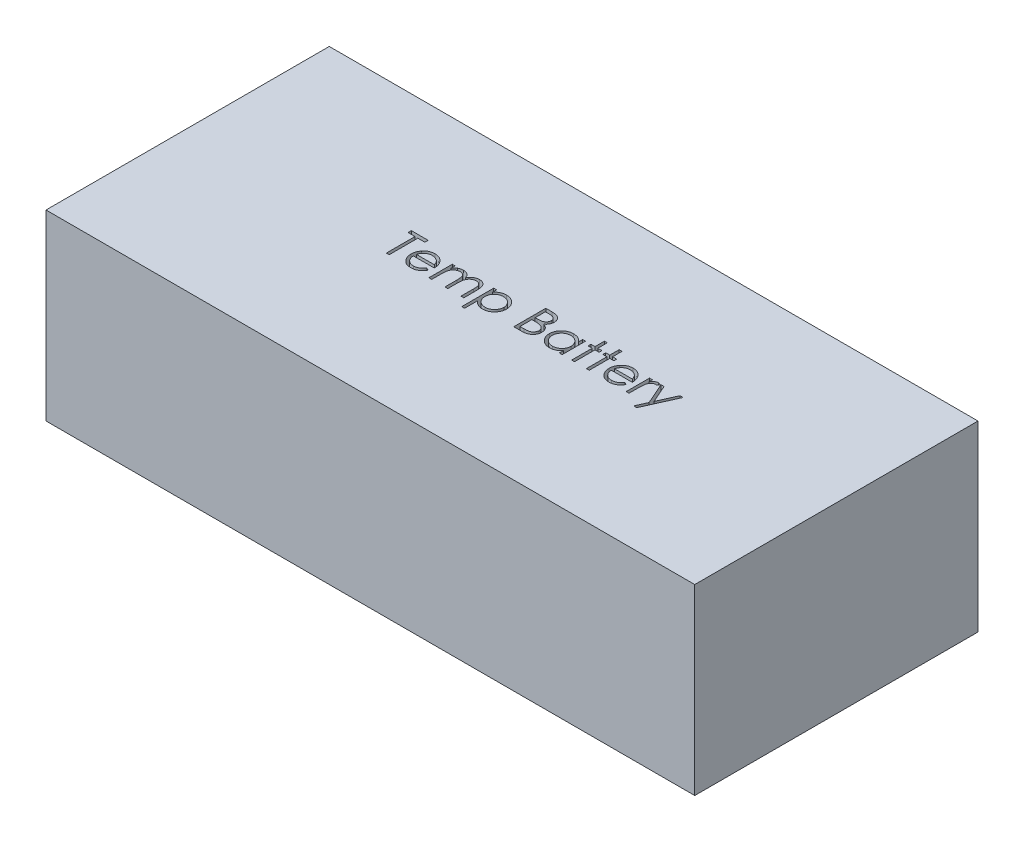
from build123d import *

# Parameters (mm, degrees)
SKETCH1_W           = 71
SKETCH1_H           = 31
BOSS_EXTRUDE1_DEPTH = 20
CUT_EXTRUDE1_DEPTH  = 4


with BuildPart() as part:
    # Sketch1 → Boss-Extrude1 (new body)
    with BuildSketch(Plane(origin=(0, 0, 0), x_dir=(1, 0, 0), z_dir=(0, 1, 0))):
        Rectangle(SKETCH1_W, SKETCH1_H)
    extrude(amount=BOSS_EXTRUDE1_DEPTH)

    # Sketch2 → Cut-Extrude1 (cut)
    # profile 1 of 11: a face of its own
    with BuildSketch(Plane(origin=(0, 20, 0), x_dir=(1, 0, 0), z_dir=(0, 1, 0))):
        Polygon((-13.555817512, 2.176797668), (-13.555817512, 2.535772027), (-11.716073922, 2.535772027), (-11.716073922, 2.176797668), (-12.478894435, 2.176797668), (-12.478894435, -0.964227973), (-12.792996999, -0.964227973), (-12.792996999, 2.176797668), align=None)
    # profile 2 of 11: a face of its own
    with BuildSketch(Plane(origin=(0, 20, 0), x_dir=(1, 0, 0), z_dir=(0, 1, 0))):
        with BuildLine():
            Line((-9.168197319, -0.156535666), (-8.889150845, -0.303070121))
            add(Edge.make_bspline(
                [(-8.889150845, -0.303070121), (-8.91138744, -0.342513452), (-8.954651049, -0.419254555), (-9.029051797, -0.524686415), (-9.107043869, -0.619534131), (-9.192147837, -0.701263785), (-9.281817516, -0.77251517), (-9.376550171, -0.834852995), (-9.476838989, -0.887971515), (-9.582688713, -0.932724043), (-9.694988265, -0.967133537), (-9.814009781, -0.991437758), (-9.939981276, -1.006461027), (-10.026327456, -1.008206168), (-10.070541069, -1.009099768)],
                knots=[0, 0, 0, 0, 1.120438281, 2.179929193, 3.190490725, 4.156257408, 5.095198341, 6.022838206, 6.959905092, 7.901321166, 8.864066838, 9.862729781, 10.905609505, 12, 12, 12, 12], degree=3))
            add(Edge.make_bspline(
                [(-10.070541069, -1.009099768), (-10.119683047, -1.007952593), (-10.215544809, -1.005714786), (-10.355084556, -0.986422322), (-10.486463974, -0.954949963), (-10.609675677, -0.910984421), (-10.72441793, -0.853557097), (-10.830918785, -0.783597616), (-10.929738311, -0.701465361), (-11.01776252, -0.606448917), (-11.097006403, -0.50476696), (-11.166932223, -0.398811076), (-11.225389654, -0.288847851), (-11.272942264, -0.175577327), (-11.311347129, -0.059713434), (-11.338113833, 0.059798034), (-11.353543581, 0.182633618), (-11.355908026, 0.265730954), (-11.357099563, 0.307606963)],
                knots=[0, 0, 0, 0, 1.145258523, 2.234067595, 3.276747158, 4.290159414, 5.277019952, 6.260822364, 7.254936242, 8.264827045, 9.274100331, 10.257902744, 11.220704747, 12.172965371, 13.118907548, 14.062713208, 15.023725156, 16, 16, 16, 16], degree=3))
            add(Edge.make_bspline(
                [(-11.357099563, 0.307606963), (-11.356040422, 0.346901793), (-11.353941343, 0.424778958), (-11.340710556, 0.540044502), (-11.317262263, 0.652072955), (-11.285085939, 0.760957403), (-11.243534693, 0.866515537), (-11.192702474, 0.9688116), (-11.132510096, 1.06773674), (-11.086037422, 1.130139874), (-11.062628409, 1.161573309)],
                knots=[0, 0, 0, 0, 1.024358464, 2.0301432, 3.019427413, 4.004406732, 4.986367066, 5.972626655, 6.978780325, 8, 8, 8, 8], degree=3))
            add(Edge.make_bspline(
                [(-11.062628409, 1.161573309), (-11.030920726, 1.199442179), (-10.96850978, 1.273980329), (-10.862953424, 1.371918655), (-10.748653228, 1.45396243), (-10.627041602, 1.521969566), (-10.496705128, 1.573643213), (-10.359395837, 1.612150796), (-10.213550251, 1.633728807), (-10.11384503, 1.63677664), (-10.06282873, 1.638336129)],
                knots=[0, 0, 0, 0, 1.030682036, 2.02871468, 2.997146059, 3.962720338, 4.930598197, 5.918074684, 6.934738563, 8, 8, 8, 8], degree=3))
            add(Edge.make_bspline(
                [(-10.06282873, 1.638336129), (-10.010381124, 1.63698208), (-9.907490878, 1.634325745), (-9.757458757, 1.609699412), (-9.615498041, 1.570646857), (-9.481665537, 1.515493067), (-9.355947676, 1.444333515), (-9.239161626, 1.356191673), (-9.129310114, 1.253773586), (-9.065401535, 1.175010377), (-9.032880813, 1.134930681)],
                knots=[0, 0, 0, 0, 1.056321875, 2.072262726, 3.055038591, 4.01806755, 4.982017516, 5.957941055, 6.960871419, 8, 8, 8, 8], degree=3))
            add(Edge.make_bspline(
                [(-9.032880813, 1.134930681), (-9.010753875, 1.104727099), (-8.966647282, 1.044520981), (-8.911400182, 0.946349823), (-8.863442787, 0.843639229), (-8.825109826, 0.734728932), (-8.794070324, 0.620909352), (-8.771613506, 0.501366807), (-8.758443887, 0.376136896), (-8.75585519, 0.29081034), (-8.75453546, 0.247310488)],
                knots=[0, 0, 0, 0, 0.94817472, 1.890038105, 2.849395472, 3.817997239, 4.812318967, 5.836947057, 6.897266129, 8, 8, 8, 8], degree=3))
            Line((-8.75453546, 0.247310488), (-11.042996999, 0.247310488))
            add(Edge.make_bspline(
                [(-11.042996999, 0.247310488), (-11.041457392, 0.213610024), (-11.038429818, 0.14733942), (-11.024314675, 0.050368637), (-11.002065902, -0.042004705), (-10.970796839, -0.129087747), (-10.932929994, -0.212017874), (-10.886544277, -0.290179911), (-10.831204723, -0.363217841), (-10.769479024, -0.431784979), (-10.700771928, -0.49284574), (-10.628489181, -0.547497516), (-10.551595616, -0.593303113), (-10.470697532, -0.630483003), (-10.385925747, -0.659589319), (-10.297253552, -0.67945714), (-10.204855436, -0.692764247), (-10.141869702, -0.694243912), (-10.10980389, -0.694997204)],
                knots=[0, 0, 0, 0, 1.094153842, 2.151609401, 3.174256925, 4.172055639, 5.149267565, 6.128595816, 7.11444997, 8.118368179, 9.117203808, 10.09244225, 11.054858984, 12.015122123, 12.976791628, 13.957293641, 14.960065497, 16, 16, 16, 16], degree=3))
            add(Edge.make_bspline(
                [(-10.10980389, -0.694997204), (-10.078452742, -0.694389147), (-10.016246051, -0.693182646), (-9.923605194, -0.681450735), (-9.832465667, -0.66248046), (-9.743204683, -0.63659047), (-9.657633837, -0.605013618), (-9.578388287, -0.56691076), (-9.505508072, -0.524761013), (-9.437391105, -0.476551338), (-9.371320112, -0.417543151), (-9.305777625, -0.34390743), (-9.235500972, -0.256819902), (-9.191511379, -0.191274236), (-9.168197319, -0.156535666)],
                knots=[0, 0, 0, 0, 0.99110716, 1.966546729, 2.947904876, 3.932708344, 4.903319531, 5.828989031, 6.710028674, 7.56322171, 8.463672341, 9.504779593, 10.677557249, 12, 12, 12, 12], degree=3))
        make_face()
        with BuildLine():
            add(Edge.make_bspline(
                [(-9.068638025, 0.561413052), (-9.080134649, 0.603075926), (-9.102261951, 0.683263547), (-9.148498315, 0.794304437), (-9.200569856, 0.892992338), (-9.262191587, 0.978571971), (-9.332010313, 1.054575484), (-9.412655495, 1.120994069), (-9.503091389, 1.18041152), (-9.60285053, 1.23056402), (-9.708492315, 1.273253879), (-9.819098507, 1.301878994), (-9.931956294, 1.321488537), (-10.008290581, 1.323314645), (-10.046702928, 1.324233565)],
                knots=[0, 0, 0, 0, 1.154881502, 2.222775134, 3.210006277, 4.132804581, 5.035138423, 5.962687519, 6.919655026, 7.923214229, 8.944639381, 9.960483929, 10.97369054, 12, 12, 12, 12], degree=3))
            add(Edge.make_bspline(
                [(-10.046702928, 1.324233565), (-10.078052367, 1.323621894), (-10.140023616, 1.322412748), (-10.231324684, 1.310942618), (-10.319004383, 1.291982773), (-10.403709671, 1.266017817), (-10.484330539, 1.231409214), (-10.562525307, 1.190825988), (-10.636305703, 1.141284404), (-10.682446999, 1.103525549), (-10.705757416, 1.084449911)],
                knots=[0, 0, 0, 0, 1.04873581, 2.073130211, 3.073294108, 4.04793562, 5.032784715, 6.005352987, 6.992311501, 8, 8, 8, 8], degree=3))
            add(Edge.make_bspline(
                [(-10.705757416, 1.084449911), (-10.722450697, 1.069355596), (-10.756233832, 1.03880838), (-10.801374353, 0.986179173), (-10.844594826, 0.929427611), (-10.883928479, 0.866382486), (-10.920006065, 0.797761707), (-10.953766042, 0.724144072), (-10.984152454, 0.644970942), (-11.001248564, 0.589798503), (-11.010044275, 0.561413052)],
                knots=[0, 0, 0, 0, 0.879870761, 1.780643979, 2.707998968, 3.669668524, 4.684282772, 5.740141944, 6.837334558, 8, 8, 8, 8], degree=3))
            Line((-11.010044275, 0.561413052), (-9.068638025, 0.561413052))
        make_face(mode=Mode.SUBTRACT)
    # profile 3 of 11: a face of its own
    with BuildSketch(Plane(origin=(0, 20, 0), x_dir=(1, 0, 0), z_dir=(0, 1, 0))):
        with BuildLine():
            Line((-8.126330332, 1.593464334), (-7.812227768, 1.593464334))
            Line((-7.812227768, 1.593464334), (-7.812227768, 1.148953117))
            add(Edge.make_bspline(
                [(-7.812227768, 1.148953117), (-7.783943818, 1.187840718), (-7.729749059, 1.262353091), (-7.640883406, 1.360543376), (-7.552107294, 1.44387153), (-7.488173912, 1.487614402), (-7.45746014, 1.508628597)],
                knots=[0, 0, 0, 0, 1.134379233, 2.173579362, 3.122582517, 4, 4, 4, 4], degree=3))
            add(Edge.make_bspline(
                [(-7.45746014, 1.508628597), (-7.415595478, 1.528633963), (-7.332597578, 1.568295176), (-7.201178353, 1.608528735), (-7.066703684, 1.633253836), (-6.97589547, 1.63663521), (-6.93021655, 1.638336129)],
                knots=[0, 0, 0, 0, 1.014936303, 2.012140481, 3.000054389, 4, 4, 4, 4], degree=3))
            add(Edge.make_bspline(
                [(-6.93021655, 1.638336129), (-6.899323554, 1.637290839), (-6.838187975, 1.635222264), (-6.747603884, 1.621762229), (-6.659745273, 1.598496056), (-6.575131243, 1.566088732), (-6.495410564, 1.526842045), (-6.422321366, 1.480792337), (-6.356697158, 1.429095262), (-6.298571107, 1.369416329), (-6.246302081, 1.30007973), (-6.198223235, 1.219215482), (-6.153798022, 1.12500782), (-6.129176714, 1.056641279), (-6.116214146, 1.020647828)],
                knots=[0, 0, 0, 0, 1.009824226, 1.998387844, 2.986035974, 3.974953746, 4.955485308, 5.885931332, 6.793869504, 7.679848016, 8.601185859, 9.625726857, 10.749998409, 12, 12, 12, 12], degree=3))
            add(Edge.make_bspline(
                [(-6.116214146, 1.020647828), (-6.102502895, 1.045372247), (-6.075521078, 1.094026432), (-6.030215441, 1.162884695), (-5.982747644, 1.227291486), (-5.932713151, 1.287297911), (-5.880288564, 1.342607641), (-5.825227164, 1.393403543), (-5.767842383, 1.439903756), (-5.688050143, 1.494226916), (-5.584237535, 1.551928097), (-5.453349421, 1.601956541), (-5.317199249, 1.63287267), (-5.224781551, 1.636502943), (-5.178113185, 1.638336129)],
                knots=[0, 0, 0, 0, 0.86119277, 1.694706429, 2.50939023, 3.298075842, 4.073795165, 4.829715201, 5.57930267, 6.321991688, 7.768977793, 9.186738141, 10.579381044, 12, 12, 12, 12], degree=3))
            add(Edge.make_bspline(
                [(-5.178113185, 1.638336129), (-5.135231722, 1.636718908), (-5.051308536, 1.63355385), (-4.92913127, 1.608700377), (-4.815189465, 1.56602273), (-4.709712389, 1.507789093), (-4.614552575, 1.43460991), (-4.531836266, 1.347541072), (-4.462065903, 1.247198449), (-4.416487263, 1.152806461), (-4.385571999, 1.069471128), (-4.366510764, 0.998464836), (-4.349671069, 0.920313284), (-4.335689824, 0.834923022), (-4.325471272, 0.741992414), (-4.317900556, 0.641673538), (-4.312776483, 0.533888426), (-4.312414411, 0.459522926), (-4.312227768, 0.421188693)],
                knots=[0, 0, 0, 0, 1.209669288, 2.367440248, 3.500751976, 4.631527125, 5.755587489, 6.87532382, 8.007944318, 9.190864318, 9.82315674, 10.514484317, 11.263564316, 12.079023757, 12.955305781, 13.901327259, 14.918167583, 16, 16, 16, 16], degree=3))
            Line((-4.312227768, 0.421188693), (-4.312227768, -0.964227973))
            Line((-4.312227768, -0.964227973), (-4.626330332, -0.964227973))
            Line((-4.626330332, -0.964227973), (-4.626330332, 0.422590937))
            add(Edge.make_bspline(
                [(-4.626330332, 0.422590937), (-4.626408215, 0.455311511), (-4.626557894, 0.518195478), (-4.629251526, 0.608447929), (-4.63432684, 0.690716286), (-4.640261479, 0.764888374), (-4.648505288, 0.831137163), (-4.65915122, 0.889329581), (-4.6704289, 0.939923393), (-4.689164891, 0.99600944), (-4.719112783, 1.057879651), (-4.764730263, 1.124603227), (-4.822200369, 1.182684027), (-4.888560525, 1.233102344), (-4.96410897, 1.274095985), (-5.047373693, 1.303371995), (-5.137837745, 1.321494873), (-5.200460533, 1.323300889), (-5.232800685, 1.324233565)],
                knots=[0, 0, 0, 0, 1.253487763, 2.409012846, 3.458416907, 4.410876679, 5.259312806, 6.014470957, 6.676830364, 7.243083969, 8.276244668, 9.299465089, 10.325150304, 11.392391894, 12.482080715, 13.603491619, 14.762376348, 16, 16, 16, 16], degree=3))
            add(Edge.make_bspline(
                [(-5.232800685, 1.324233565), (-5.272470639, 1.322817408), (-5.35087355, 1.320018542), (-5.465319037, 1.29144467), (-5.575290053, 1.248364419), (-5.677505186, 1.185931962), (-5.771532977, 1.111123598), (-5.852432554, 1.022174002), (-5.91926474, 0.921544075), (-5.964518716, 0.828397373), (-5.993108017, 0.744727929), (-6.011984933, 0.671630557), (-6.026668325, 0.588548989), (-6.040438854, 0.496041498), (-6.049426582, 0.393471318), (-6.057594954, 0.281312917), (-6.061415817, 0.159228957), (-6.061950276, 0.074602269), (-6.062227768, 0.030663854)],
                knots=[0, 0, 0, 0, 1.090531906, 2.155305635, 3.229839962, 4.33261226, 5.44038871, 6.529323825, 7.629011124, 8.757537029, 9.370236727, 10.061839251, 10.834451254, 11.692844982, 12.636905849, 13.66920014, 14.789842145, 16, 16, 16, 16], degree=3))
            Line((-6.062227768, 0.030663854), (-6.062227768, -0.964227973))
            Line((-6.062227768, -0.964227973), (-6.376330332, -0.964227973))
            Line((-6.376330332, -0.964227973), (-6.376330332, 0.336352956))
            add(Edge.make_bspline(
                [(-6.376330332, 0.336352956), (-6.376409763, 0.373046275), (-6.37656258, 0.443640532), (-6.379238898, 0.544874208), (-6.384325519, 0.636955288), (-6.390206068, 0.719776751), (-6.398666246, 0.79318808), (-6.408276008, 0.857582838), (-6.419624619, 0.912799589), (-6.438414504, 0.973362974), (-6.467128972, 1.040083897), (-6.513317234, 1.111224918), (-6.570924814, 1.173493016), (-6.63849569, 1.226651764), (-6.714501372, 1.270593246), (-6.798484773, 1.302252997), (-6.889689686, 1.320677287), (-6.952567392, 1.323025784), (-6.98490405, 1.324233565)],
                knots=[0, 0, 0, 0, 1.320475261, 2.540461679, 3.643808994, 4.639130445, 5.527981419, 6.302341397, 6.981980563, 7.553956391, 8.582137848, 9.585246428, 10.591171744, 11.620968678, 12.668337649, 13.738356861, 14.836885341, 16, 16, 16, 16], degree=3))
            add(Edge.make_bspline(
                [(-6.98490405, 1.324233565), (-7.022920262, 1.322703105), (-7.098685221, 1.319652953), (-7.209987191, 1.292198679), (-7.317472874, 1.249194604), (-7.419427573, 1.189534785), (-7.513101721, 1.115635706), (-7.595109989, 1.028720811), (-7.664052514, 0.929871777), (-7.709784329, 0.837707261), (-7.739282803, 0.756133986), (-7.758878138, 0.686783038), (-7.775717764, 0.60978279), (-7.788231785, 0.524895679), (-7.800312201, 0.432674585), (-7.80614251, 0.332660095), (-7.811814072, 0.224938007), (-7.812086487, 0.150565462), (-7.812227768, 0.111993982)],
                knots=[0, 0, 0, 0, 1.098833095, 2.189935336, 3.297829714, 4.440610912, 5.596351641, 6.740013378, 7.886572111, 9.072425424, 9.705826452, 10.395263256, 11.156850408, 11.985370555, 12.878090359, 13.847760091, 14.883794034, 16, 16, 16, 16], degree=3))
            Line((-7.812227768, 0.111993982), (-7.812227768, -0.964227973))
            Line((-7.812227768, -0.964227973), (-8.126330332, -0.964227973))
            Line((-8.126330332, -0.964227973), (-8.126330332, 1.593464334))
        make_face()
    # profile 4 of 11: a face of its own
    with BuildSketch(Plane(origin=(0, 20, 0), x_dir=(1, 0, 0), z_dir=(0, 1, 0))):
        with BuildLine():
            Line((-3.59427905, 1.593464334), (-3.280176486, 1.593464334))
            Line((-3.280176486, 1.593464334), (-3.280176486, 1.120207123))
            add(Edge.make_bspline(
                [(-3.280176486, 1.120207123), (-3.246819002, 1.163144857), (-3.181995407, 1.24658575), (-3.070270502, 1.354575878), (-2.952343694, 1.445651182), (-2.825180281, 1.517033715), (-2.690756591, 1.570854527), (-2.549624274, 1.610633977), (-2.400585509, 1.634075451), (-2.298689056, 1.636897112), (-2.24672296, 1.638336129)],
                knots=[0, 0, 0, 0, 1.0828784, 2.104357462, 3.088488658, 4.04616522, 5.001424249, 5.969181776, 6.964304535, 8, 8, 8, 8], degree=3))
            add(Edge.make_bspline(
                [(-2.24672296, 1.638336129), (-2.201331357, 1.63702295), (-2.111612469, 1.634427383), (-1.97954924, 1.616854329), (-1.852373856, 1.586736636), (-1.730805802, 1.543335721), (-1.613542737, 1.489680251), (-1.502320637, 1.421963216), (-1.395407082, 1.343557025), (-1.295490893, 1.253324874), (-1.203169525, 1.155696607), (-1.123323344, 1.050674303), (-1.05445144, 0.941711717), (-0.998781143, 0.827119625), (-0.955172796, 0.707800395), (-0.924158118, 0.583271954), (-0.905700475, 0.453996014), (-0.903224023, 0.366093293), (-0.901971358, 0.321629399)],
                knots=[0, 0, 0, 0, 1.041296284, 2.058176809, 3.050446431, 4.034000596, 5.01514041, 6.003636468, 7.015969324, 8.052561599, 9.08815499, 10.094063707, 11.074456064, 12.040834395, 13.011057502, 13.983766392, 14.980127149, 16, 16, 16, 16], degree=3))
            add(Edge.make_bspline(
                [(-0.901971358, 0.321629399), (-0.903196843, 0.27622709), (-0.905613678, 0.186687186), (-0.924358684, 0.055200088), (-0.954315558, -0.071287286), (-0.997373741, -0.192564549), (-1.053015229, -0.3085482), (-1.12071979, -0.419154596), (-1.200606257, -0.5243483), (-1.291907385, -0.6227012), (-1.390960321, -0.713300513), (-1.49683781, -0.792538582), (-1.607896736, -0.859079958), (-1.723568903, -0.914662917), (-1.844844541, -0.956555101), (-1.971157819, -0.986772902), (-2.102439965, -1.005407397), (-2.191741117, -1.00785954), (-2.236907255, -1.009099768)],
                knots=[0, 0, 0, 0, 1.038740735, 2.04854663, 3.033179607, 4.009277356, 4.987731542, 5.972001279, 6.972200261, 8.005528982, 9.039189865, 10.040446548, 11.026516639, 11.997840187, 12.972163198, 13.956796175, 14.96660207, 16, 16, 16, 16], degree=3))
            add(Edge.make_bspline(
                [(-2.236907255, -1.009099768), (-2.287734827, -1.00780496), (-2.388134183, -1.005247336), (-2.534931854, -0.979327925), (-2.676208706, -0.94059099), (-2.81039953, -0.883891996), (-2.938567343, -0.81163648), (-3.059987149, -0.723526274), (-3.175303902, -0.61974565), (-3.244712659, -0.541013833), (-3.280176486, -0.500786467)],
                knots=[0, 0, 0, 0, 1.014726462, 2.004382257, 2.969841629, 3.936926163, 4.907207904, 5.903978561, 6.929055279, 8, 8, 8, 8], degree=3))
            Line((-3.280176486, -0.500786467), (-3.280176486, -1.906535666))
            Line((-3.280176486, -1.906535666), (-3.59427905, -1.906535666))
            Line((-3.59427905, -1.906535666), (-3.59427905, 1.593464334))
        make_face()
        with BuildLine():
            add(Edge.make_bspline(
                [(-2.249527448, 1.324233565), (-2.28510701, 1.323593307), (-2.355153998, 1.322332804), (-2.457826217, 1.307358855), (-2.556721645, 1.285621114), (-2.650843596, 1.252709213), (-2.741094212, 1.2123104), (-2.826778377, 1.161828389), (-2.907835945, 1.102176383), (-2.984062975, 1.034497039), (-3.052926269, 0.959922351), (-3.113889197, 0.880334542), (-3.165096502, 0.795834402), (-3.207598522, 0.70720904), (-3.239941805, 0.613763755), (-3.262897524, 0.516030742), (-3.277327877, 0.41390303), (-3.279216815, 0.344347023), (-3.280176486, 0.309009206)],
                knots=[0, 0, 0, 0, 1.05670511, 2.080379991, 3.077984906, 4.06214886, 5.038337365, 6.01289324, 7.01187578, 8.025460281, 9.038092164, 10.024533457, 11.000252242, 11.969694649, 12.940728589, 13.933144304, 14.949937299, 16, 16, 16, 16], degree=3))
            add(Edge.make_bspline(
                [(-3.280176486, 0.309009206), (-3.27858563, 0.262621094), (-3.275469008, 0.171742853), (-3.25013164, 0.038958731), (-3.208896376, -0.086692925), (-3.150367662, -0.204153962), (-3.076420088, -0.312136797), (-2.987321932, -0.408827404), (-2.883879381, -0.493617995), (-2.767812189, -0.565039248), (-2.643390058, -0.623027315), (-2.513604146, -0.664541525), (-2.380239265, -0.690113753), (-2.290070946, -0.693360572), (-2.244619595, -0.694997204)],
                knots=[0, 0, 0, 0, 1.03728447, 2.032128127, 3.01272805, 3.987917167, 4.958271349, 5.931593992, 6.91984656, 7.941419022, 8.973179163, 9.983609215, 10.983593296, 12, 12, 12, 12], degree=3))
            add(Edge.make_bspline(
                [(-2.244619595, -0.694997204), (-2.200083827, -0.693440827), (-2.111688334, -0.690351699), (-1.981530213, -0.663613511), (-1.855039574, -0.622768487), (-1.734859402, -0.56320893), (-1.622035914, -0.490218872), (-1.52015436, -0.402658839), (-1.431147447, -0.301168896), (-1.355283092, -0.188160393), (-1.294151606, -0.066985009), (-1.248221367, 0.058396379), (-1.221712793, 0.187541802), (-1.217956005, 0.274539515), (-1.216073922, 0.31812379)],
                knots=[0, 0, 0, 0, 1.00104056, 1.986885549, 2.97790532, 3.984399681, 4.995088187, 5.994304198, 6.996462723, 8.023150851, 9.048424203, 10.043036403, 11.019596776, 12, 12, 12, 12], degree=3))
            add(Edge.make_bspline(
                [(-1.216073922, 0.31812379), (-1.217528656, 0.361978779), (-1.22042679, 0.449347082), (-1.248973827, 0.578109985), (-1.291873805, 0.703997961), (-1.354432857, 0.823518511), (-1.428634126, 0.936292594), (-1.518381123, 1.035846473), (-1.61899732, 1.123017146), (-1.731686484, 1.195032555), (-1.852626909, 1.25231805), (-1.979941825, 1.294201689), (-2.112985428, 1.319375439), (-2.203613082, 1.322599945), (-2.249527448, 1.324233565)],
                knots=[0, 0, 0, 0, 0.983928682, 1.960191568, 2.949917689, 3.96440592, 4.982380491, 5.975291189, 6.965713506, 7.964880129, 8.970154049, 9.96478489, 10.968906225, 12, 12, 12, 12], degree=3))
        make_face(mode=Mode.SUBTRACT)
    # profile 5 of 11: a face of its own
    with BuildSketch(Plane(origin=(0, 20, 0), x_dir=(1, 0, 0), z_dir=(0, 1, 0))):
        with BuildLine():
            Line((1.162131206, 2.535772027), (1.845023834, 2.535772027))
            add(Edge.make_bspline(
                [(1.845023834, 2.535772027), (1.878452313, 2.535596276), (1.943245023, 2.535255628), (2.037464465, 2.529972497), (2.125713275, 2.522768827), (2.208017048, 2.511338735), (2.28433775, 2.497546958), (2.354905387, 2.480845141), (2.41949556, 2.460818528), (2.496608296, 2.428972247), (2.584528957, 2.381649078), (2.67972735, 2.311720513), (2.761131589, 2.22618805), (2.831317906, 2.129705395), (2.887119026, 2.023569623), (2.927488323, 1.910310434), (2.953046199, 1.791388692), (2.955674633, 1.709745514), (2.957003001, 1.668484367)],
                knots=[0, 0, 0, 0, 1.001505555, 1.941167018, 2.826882275, 3.653841531, 4.429895133, 5.150066043, 5.825578002, 6.45369114, 7.647487171, 8.808567382, 9.977351308, 11.170798116, 12.373658725, 13.556498008, 14.765093433, 16, 16, 16, 16], degree=3))
            add(Edge.make_bspline(
                [(2.957003001, 1.668484367), (2.955909783, 1.629831811), (2.953761505, 1.553875894), (2.933218746, 1.442781785), (2.901058078, 1.337030566), (2.856352828, 1.23700818), (2.798250832, 1.144974567), (2.729392514, 1.060187301), (2.646315711, 0.986236244), (2.584072471, 0.944893342), (2.552455725, 0.92389302)],
                knots=[0, 0, 0, 0, 1.044552857, 2.05264487, 3.044412934, 4.028983338, 5.005914585, 5.980388656, 6.974128949, 8, 8, 8, 8], degree=3))
            add(Edge.make_bspline(
                [(2.552455725, 0.92389302), (2.592216153, 0.908628021), (2.6682877, 0.879422297), (2.772973713, 0.827786833), (2.863168558, 0.771624723), (2.939565704, 0.710292872), (3.004903359, 0.644184062), (3.0619563, 0.572328947), (3.110637675, 0.49379019), (3.152350598, 0.409386654), (3.184899354, 0.319980186), (3.209275258, 0.22640941), (3.223242708, 0.129009855), (3.225230349, 0.062724475), (3.22623377, 0.02926161)],
                knots=[0, 0, 0, 0, 1.27268992, 2.434971085, 3.483601985, 4.442670788, 5.356604649, 6.2567628, 7.179492994, 8.113709626, 9.066344395, 10.018646069, 10.999752585, 12, 12, 12, 12], degree=3))
            add(Edge.make_bspline(
                [(3.22623377, 0.02926161), (3.225256924, -0.004905262), (3.223334952, -0.07212954), (3.209154981, -0.170884675), (3.185145874, -0.265259621), (3.152074727, -0.355864804), (3.108912413, -0.442524938), (3.056384448, -0.525338202), (2.993752885, -0.603472533), (2.923690016, -0.677796156), (2.84442787, -0.744623944), (2.758912115, -0.80413965), (2.666065795, -0.853085712), (2.567413801, -0.894201734), (2.461849485, -0.925608932), (2.349846878, -0.947581506), (2.231502576, -0.962386543), (2.150292825, -0.963603748), (2.108645629, -0.964227973)],
                knots=[0, 0, 0, 0, 0.978564426, 1.925352924, 2.850884081, 3.763762016, 4.682927383, 5.618979971, 6.567305752, 7.547517671, 8.540179244, 9.531824382, 10.526200242, 11.540722885, 12.589160233, 13.674978461, 14.80764778, 16, 16, 16, 16], degree=3))
            Line((2.108645629, -0.964227973), (1.162131206, -0.964227973))
            Line((1.162131206, -0.964227973), (1.162131206, 2.535772027))
        make_face()
        with BuildLine():
            Line((1.47623377, 2.176797668), (1.47623377, 1.055002796))
            Line((1.47623377, 1.055002796), (1.687271431, 1.055002796))
            add(Edge.make_bspline(
                [(1.687271431, 1.055002796), (1.718120226, 1.055402719), (1.777726385, 1.056175452), (1.864046282, 1.058388969), (1.9441713, 1.064587012), (2.017963133, 1.070783274), (2.085305577, 1.080857862), (2.146049439, 1.092849985), (2.201148035, 1.10553289), (2.264687581, 1.127102377), (2.336760529, 1.158980052), (2.413593634, 1.208451888), (2.481328103, 1.267376241), (2.538525291, 1.335367203), (2.585336761, 1.410233389), (2.617850477, 1.490780269), (2.639897761, 1.575000401), (2.641889292, 1.632818654), (2.642900437, 1.66217427)],
                knots=[0, 0, 0, 0, 1.156816544, 2.235205308, 3.236616184, 4.169592532, 5.011045266, 5.787822928, 6.49130361, 7.128639758, 8.301311294, 9.436451833, 10.541879658, 11.654887649, 12.756523258, 13.837046038, 14.901820046, 16, 16, 16, 16], degree=3))
            add(Edge.make_bspline(
                [(2.642900437, 1.66217427), (2.642374257, 1.681600042), (2.641342097, 1.719705814), (2.632888794, 1.775255168), (2.61852122, 1.827498921), (2.600066927, 1.877153031), (2.574278238, 1.922664881), (2.543914775, 1.965608077), (2.507229084, 2.004520195), (2.465471772, 2.040889694), (2.417463149, 2.073134221), (2.363231857, 2.101374985), (2.30204418, 2.124115761), (2.234931325, 2.144031914), (2.160860237, 2.158020208), (2.080685684, 2.169673595), (1.993750965, 2.175606337), (1.933605863, 2.1763917), (1.902515822, 2.176797668)],
                knots=[0, 0, 0, 0, 0.91205012, 1.789085906, 2.630437955, 3.453916878, 4.269457761, 5.079663411, 5.91843418, 6.774407191, 7.675494373, 8.627863946, 9.638891023, 10.736472738, 11.911756761, 13.175263542, 14.539845004, 16, 16, 16, 16], degree=3))
            Line((1.902515822, 2.176797668), (1.47623377, 2.176797668))
        make_face(mode=Mode.SUBTRACT)
        with BuildLine():
            Line((1.47623377, 0.696028437), (1.47623377, -0.605253614))
            Line((1.47623377, -0.605253614), (1.923549475, -0.605253614))
            add(Edge.make_bspline(
                [(1.923549475, -0.605253614), (1.955568401, -0.604869867), (2.01728066, -0.604130244), (2.10638189, -0.60171569), (2.188964994, -0.596223414), (2.26465313, -0.587577564), (2.334263582, -0.578199115), (2.396961285, -0.565587834), (2.453254479, -0.551138874), (2.518528786, -0.528804702), (2.592032295, -0.494108231), (2.671243151, -0.441794004), (2.741669369, -0.379470696), (2.801474629, -0.307339782), (2.850487617, -0.228908455), (2.886143072, -0.145763105), (2.908133929, -0.059277578), (2.910796098, -0.000310865), (2.912131206, 0.02926161)],
                knots=[0, 0, 0, 0, 1.160039823, 2.235823828, 3.228722157, 4.157150951, 4.99529583, 5.772374946, 6.472645482, 7.099169577, 8.269452708, 9.405989375, 10.527446681, 11.663510218, 12.788923519, 13.866172445, 14.929861265, 16, 16, 16, 16], degree=3))
            add(Edge.make_bspline(
                [(2.912131206, 0.02926161), (2.911855102, 0.047754951), (2.911307347, 0.084443332), (2.903046732, 0.138359152), (2.891032862, 0.190585025), (2.875501428, 0.241262765), (2.852881961, 0.289476142), (2.826475416, 0.336178701), (2.795514014, 0.381432181), (2.747269849, 0.438644434), (2.677097864, 0.504561447), (2.577391089, 0.569098949), (2.464018791, 0.621146756), (2.381791298, 0.643246233), (2.3393147, 0.654662251)],
                knots=[0, 0, 0, 0, 0.723448775, 1.435228256, 2.130040452, 2.821711965, 3.505591119, 4.210454504, 4.921174351, 5.648778258, 7.137944449, 8.670945889, 10.280296675, 12, 12, 12, 12], degree=3))
            add(Edge.make_bspline(
                [(2.3393147, 0.654662251), (2.322285604, 0.658117335), (2.285363012, 0.66560867), (2.225155431, 0.673516373), (2.156419562, 0.680561433), (2.078996685, 0.685772591), (1.992788844, 0.691159134), (1.897611925, 0.693253955), (1.793854611, 0.695753215), (1.721862238, 0.69593435), (1.684466943, 0.696028437)],
                knots=[0, 0, 0, 0, 0.634451884, 1.375622551, 2.216452059, 3.157844607, 4.20941857, 5.370758133, 6.634282058, 8, 8, 8, 8], degree=3))
            Line((1.684466943, 0.696028437), (1.47623377, 0.696028437))
        make_face(mode=Mode.SUBTRACT)
    # profile 6 of 11: a face of its own
    with BuildSketch(Plane(origin=(0, 20, 0), x_dir=(1, 0, 0), z_dir=(0, 1, 0))):
        with BuildLine():
            Line((6.457003001, 1.593464334), (6.457003001, -0.964227973))
            Line((6.457003001, -0.964227973), (6.142900437, -0.964227973))
            Line((6.142900437, -0.964227973), (6.142900437, -0.521820121))
            add(Edge.make_bspline(
                [(6.142900437, -0.521820121), (6.107481646, -0.561859715), (6.038361431, -0.639997486), (5.922920313, -0.742079658), (5.800552135, -0.82645798), (5.671850814, -0.894607895), (5.536932571, -0.945799952), (5.396096483, -0.982186111), (5.249285103, -1.005579946), (5.149032748, -1.007915968), (5.098228963, -1.009099768)],
                knots=[0, 0, 0, 0, 1.074387032, 2.096679803, 3.090159297, 4.057316773, 5.018401886, 5.985159533, 6.978961417, 8, 8, 8, 8], degree=3))
            add(Edge.make_bspline(
                [(5.098228963, -1.009099768), (5.053061009, -1.007873396), (4.963987804, -1.005454935), (4.832958727, -0.986692632), (4.706866477, -0.95656201), (4.585591905, -0.914661121), (4.469919759, -0.859080299), (4.358859663, -0.792539051), (4.252986971, -0.713298221), (4.153915432, -0.622710193), (4.062683431, -0.524315205), (3.982622159, -0.419369658), (3.915869079, -0.308327355), (3.860048998, -0.192594201), (3.817052654, -0.071279281), (3.787079019, 0.055197887), (3.768338573, 0.18668776), (3.765921112, 0.276227283), (3.764695309, 0.321629399)],
                knots=[0, 0, 0, 0, 1.033919861, 2.038935746, 3.024066025, 3.998881131, 4.97069526, 5.957263378, 6.95902576, 7.993208707, 9.027059324, 10.027763471, 11.009749337, 11.988697705, 12.965288445, 13.950418724, 14.960734635, 16, 16, 16, 16], degree=3))
            add(Edge.make_bspline(
                [(3.764695309, 0.321629399), (3.76594828, 0.366093102), (3.768425337, 0.453995445), (3.786878557, 0.583274143), (3.817909566, 0.707792404), (3.861457413, 0.827149347), (3.917299368, 0.941489398), (3.985227455, 1.050893423), (4.06524658, 1.15566282), (4.157498987, 1.253334047), (4.257433757, 1.343554661), (4.364342488, 1.421963707), (4.475565769, 1.489680555), (4.59282878, 1.543334032), (4.714395885, 1.586743136), (4.84134933, 1.616776104), (4.973160909, 1.634473426), (5.062651401, 1.63703619), (5.108044668, 1.638336129)],
                knots=[0, 0, 0, 0, 1.020392517, 2.01726096, 2.990465484, 3.961182959, 4.928053699, 5.906110375, 6.912531644, 7.948652711, 8.985773172, 9.998621852, 10.987621588, 11.969261332, 12.953316658, 13.946091881, 14.958173133, 16, 16, 16, 16], degree=3))
            add(Edge.make_bspline(
                [(5.108044668, 1.638336129), (5.160244527, 1.636898378), (5.262605987, 1.634079015), (5.412333996, 1.610616288), (5.553978474, 1.57097782), (5.688632826, 1.517060322), (5.815813512, 1.445411593), (5.934316496, 1.355031632), (6.04538198, 1.246490445), (6.109762271, 1.163120001), (6.142900437, 1.120207123)],
                knots=[0, 0, 0, 0, 1.038897134, 2.037228247, 3.008116434, 3.962042015, 4.918381754, 5.904844433, 6.921570401, 8, 8, 8, 8], degree=3))
            Line((6.142900437, 1.120207123), (6.142900437, 1.593464334))
            Line((6.142900437, 1.593464334), (6.457003001, 1.593464334))
        make_face()
        with BuildLine():
            add(Edge.make_bspline(
                [(5.112251399, 1.324233565), (5.066337061, 1.322599928), (4.975709461, 1.319375386), (4.842665459, 1.294201891), (4.715352045, 1.252317297), (4.59440597, 1.195035396), (4.481737754, 1.123006659), (4.381044083, 1.035885276), (4.291501381, 0.936048262), (4.216193117, 0.823946151), (4.15480262, 0.70376806), (4.111635588, 0.578143622), (4.083166341, 0.449338645), (4.08025782, 0.361975959), (4.078797873, 0.31812379)],
                knots=[0, 0, 0, 0, 1.031046209, 2.035121221, 3.029706178, 4.034933723, 5.034054252, 6.02443088, 7.017295772, 8.038157696, 9.050218397, 10.03989886, 11.016116709, 12, 12, 12, 12], degree=3))
            add(Edge.make_bspline(
                [(4.078797873, 0.31812379), (4.080662766, 0.274533682), (4.084385243, 0.187524327), (4.111135938, 0.05854375), (4.156015811, -0.067110292), (4.217257874, -0.188371286), (4.293944498, -0.300955386), (4.382833151, -0.402695509), (4.484783432, -0.490185097), (4.597710939, -0.563422671), (4.71831891, -0.622585192), (4.845152841, -0.663750831), (4.975828479, -0.690328612), (5.064680813, -0.693433088), (5.109446911, -0.694997204)],
                knots=[0, 0, 0, 0, 0.979072187, 1.954306742, 2.945804271, 3.96968567, 4.997920485, 5.998718438, 6.996577872, 8.005894225, 9.015743152, 10.005417472, 10.995077863, 12, 12, 12, 12], degree=3))
            add(Edge.make_bspline(
                [(5.109446911, -0.694997204), (5.154893414, -0.69333724), (5.245282001, -0.690035736), (5.378720709, -0.664754471), (5.508215671, -0.622985673), (5.6320029, -0.565086546), (5.747319031, -0.49332919), (5.850816908, -0.409322099), (5.938332877, -0.311618915), (6.012525486, -0.204242462), (6.070700903, -0.086530466), (6.113076962, 0.038803725), (6.138130868, 0.171764473), (6.141288598, 0.2626284), (6.142900437, 0.309009206)],
                knots=[0, 0, 0, 0, 1.01762866, 2.023962475, 3.030623092, 4.058876274, 5.077231937, 6.066672613, 7.034107872, 8.005628644, 8.981990164, 9.965428785, 10.961468474, 12, 12, 12, 12], degree=3))
            add(Edge.make_bspline(
                [(6.142900437, 0.309009206), (6.141940781, 0.344347037), (6.140051873, 0.41390307), (6.125621304, 0.516030588), (6.102666377, 0.613764314), (6.070320207, 0.707207003), (6.027828923, 0.795842018), (5.976581157, 0.880305778), (5.915675707, 0.96015899), (5.846093011, 1.034302061), (5.769927809, 1.101928523), (5.689333268, 1.162292764), (5.603354521, 1.211881536), (5.513437484, 1.252922808), (5.41942615, 1.285581958), (5.32055553, 1.307369652), (5.217876543, 1.322329973), (5.147830487, 1.323592353), (5.112251399, 1.324233565)],
                knots=[0, 0, 0, 0, 1.050140795, 2.067009409, 3.05949893, 4.030605086, 5.00011959, 5.97591094, 6.962425594, 7.979863591, 8.993523472, 9.986985069, 10.967611495, 11.937549037, 12.921786183, 13.919465291, 14.943216303, 16, 16, 16, 16], degree=3))
        make_face(mode=Mode.SUBTRACT)
    # profile 7 of 11: a face of its own
    with BuildSketch(Plane(origin=(0, 20, 0), x_dir=(1, 0, 0), z_dir=(0, 1, 0))):
        Polygon((7.489054283, 2.625515617), (7.803156847, 2.625515617), (7.803156847, 1.593464334), (8.251874796, 1.593464334), (8.251874796, 1.27936177), (7.803156847, 1.27936177), (7.803156847, -0.964227973), (7.489054283, -0.964227973), (7.489054283, 1.27936177), (7.040336334, 1.27936177), (7.040336334, 1.593464334), (7.489054283, 1.593464334), align=None)
    # profile 8 of 11: a face of its own
    with BuildSketch(Plane(origin=(0, 20, 0), x_dir=(1, 0, 0), z_dir=(0, 1, 0))):
        Polygon((9.104438899, 2.625515617), (9.418541463, 2.625515617), (9.418541463, 1.593464334), (9.867259411, 1.593464334), (9.867259411, 1.27936177), (9.418541463, 1.27936177), (9.418541463, -0.964227973), (9.104438899, -0.964227973), (9.104438899, 1.27936177), (8.65572095, 1.27936177), (8.65572095, 1.593464334), (9.104438899, 1.593464334), align=None)
    # profile 9 of 11: a face of its own
    with BuildSketch(Plane(origin=(0, 20, 0), x_dir=(1, 0, 0), z_dir=(0, 1, 0))):
        with BuildLine():
            Line((12.504879604, -0.156535666), (12.783926078, -0.303070121))
            add(Edge.make_bspline(
                [(12.783926078, -0.303070121), (12.761689483, -0.342513452), (12.718425874, -0.419254555), (12.644025126, -0.524686415), (12.566033054, -0.619534131), (12.480929086, -0.701263785), (12.391259407, -0.77251517), (12.296526752, -0.834852995), (12.196237934, -0.887971515), (12.09038821, -0.932724043), (11.978088658, -0.967133537), (11.859067142, -0.991437758), (11.733095647, -1.006461027), (11.646749467, -1.008206168), (11.602535854, -1.009099768)],
                knots=[0, 0, 0, 0, 1.120438281, 2.179929193, 3.190490725, 4.156257408, 5.095198341, 6.022838206, 6.959905092, 7.901321166, 8.864066838, 9.862729781, 10.905609505, 12, 12, 12, 12], degree=3))
            add(Edge.make_bspline(
                [(11.602535854, -1.009099768), (11.553393876, -1.007952593), (11.457532115, -1.005714786), (11.317992367, -0.986422322), (11.186612949, -0.954949963), (11.063401246, -0.910984421), (10.948658993, -0.853557097), (10.842158138, -0.783597616), (10.743338612, -0.701465361), (10.655314403, -0.606448917), (10.57607052, -0.50476696), (10.506144701, -0.398811076), (10.447687269, -0.288847851), (10.400134659, -0.175577327), (10.361729794, -0.059713434), (10.334963091, 0.059798034), (10.319533343, 0.182633618), (10.317168897, 0.265730954), (10.31597736, 0.307606963)],
                knots=[0, 0, 0, 0, 1.145258523, 2.234067595, 3.276747158, 4.290159414, 5.277019952, 6.260822364, 7.254936242, 8.264827045, 9.274100331, 10.257902744, 11.220704747, 12.172965371, 13.118907548, 14.062713208, 15.023725156, 16, 16, 16, 16], degree=3))
            add(Edge.make_bspline(
                [(10.31597736, 0.307606963), (10.317036501, 0.346901793), (10.31913558, 0.424778958), (10.332366367, 0.540044502), (10.35581466, 0.652072955), (10.387990984, 0.760957403), (10.42954223, 0.866515537), (10.480374449, 0.9688116), (10.540566827, 1.06773674), (10.587039501, 1.130139874), (10.610448514, 1.161573309)],
                knots=[0, 0, 0, 0, 1.024358464, 2.0301432, 3.019427413, 4.004406732, 4.986367066, 5.972626655, 6.978780325, 8, 8, 8, 8], degree=3))
            add(Edge.make_bspline(
                [(10.610448514, 1.161573309), (10.642156197, 1.199442179), (10.704567143, 1.273980329), (10.810123499, 1.371918655), (10.924423695, 1.45396243), (11.046035321, 1.521969566), (11.176371795, 1.573643213), (11.313681086, 1.612150796), (11.459526672, 1.633728807), (11.559231893, 1.63677664), (11.610248193, 1.638336129)],
                knots=[0, 0, 0, 0, 1.030682036, 2.02871468, 2.997146059, 3.962720338, 4.930598197, 5.918074684, 6.934738563, 8, 8, 8, 8], degree=3))
            add(Edge.make_bspline(
                [(11.610248193, 1.638336129), (11.662695799, 1.63698208), (11.765586045, 1.634325745), (11.915618166, 1.609699412), (12.057578882, 1.570646857), (12.191411387, 1.515493067), (12.317129247, 1.444333515), (12.433915297, 1.356191673), (12.543766809, 1.253773586), (12.607675388, 1.175010377), (12.64019611, 1.134930681)],
                knots=[0, 0, 0, 0, 1.056321875, 2.072262726, 3.055038591, 4.01806755, 4.982017516, 5.957941055, 6.960871419, 8, 8, 8, 8], degree=3))
            add(Edge.make_bspline(
                [(12.64019611, 1.134930681), (12.662323048, 1.104727099), (12.706429642, 1.044520981), (12.761676742, 0.946349823), (12.809634137, 0.843639229), (12.847967098, 0.734728932), (12.879006599, 0.620909352), (12.901463417, 0.501366807), (12.914633036, 0.376136896), (12.917221733, 0.29081034), (12.918541463, 0.247310488)],
                knots=[0, 0, 0, 0, 0.94817472, 1.890038105, 2.849395472, 3.817997239, 4.812318967, 5.836947057, 6.897266129, 8, 8, 8, 8], degree=3))
            Line((12.918541463, 0.247310488), (10.630079924, 0.247310488))
            add(Edge.make_bspline(
                [(10.630079924, 0.247310488), (10.631619531, 0.213610024), (10.634647105, 0.14733942), (10.648762248, 0.050368637), (10.671011022, -0.042004705), (10.702280084, -0.129087747), (10.740146929, -0.212017874), (10.786532646, -0.290179911), (10.8418722, -0.363217841), (10.9035979, -0.431784979), (10.972304995, -0.49284574), (11.044587742, -0.547497516), (11.121481307, -0.593303113), (11.202379391, -0.630483003), (11.287151176, -0.659589319), (11.375823371, -0.67945714), (11.468221487, -0.692764247), (11.531207221, -0.694243912), (11.563273033, -0.694997204)],
                knots=[0, 0, 0, 0, 1.094153842, 2.151609401, 3.174256925, 4.172055639, 5.149267565, 6.128595816, 7.11444997, 8.118368179, 9.117203808, 10.09244225, 11.054858984, 12.015122123, 12.976791628, 13.957293641, 14.960065497, 16, 16, 16, 16], degree=3))
            add(Edge.make_bspline(
                [(11.563273033, -0.694997204), (11.594624181, -0.694389147), (11.656830872, -0.693182646), (11.749471729, -0.681450735), (11.840611256, -0.66248046), (11.92987224, -0.63659047), (12.015443086, -0.605013618), (12.094688636, -0.56691076), (12.167568851, -0.524761013), (12.235685818, -0.476551338), (12.301756811, -0.417543151), (12.367299298, -0.34390743), (12.437575951, -0.256819902), (12.481565544, -0.191274236), (12.504879604, -0.156535666)],
                knots=[0, 0, 0, 0, 0.99110716, 1.966546729, 2.947904876, 3.932708344, 4.903319531, 5.828989031, 6.710028674, 7.56322171, 8.463672341, 9.504779593, 10.677557249, 12, 12, 12, 12], degree=3))
        make_face()
        with BuildLine():
            add(Edge.make_bspline(
                [(12.604438899, 0.561413052), (12.592942274, 0.603075926), (12.570814973, 0.683263547), (12.524578608, 0.794304437), (12.472507067, 0.892992338), (12.410885336, 0.978571971), (12.34106661, 1.054575484), (12.260421428, 1.120994069), (12.169985534, 1.18041152), (12.070226394, 1.23056402), (11.964584608, 1.273253879), (11.853978417, 1.301878994), (11.741120629, 1.321488537), (11.664786342, 1.323314645), (11.626373995, 1.324233565)],
                knots=[0, 0, 0, 0, 1.154881502, 2.222775134, 3.210006277, 4.132804581, 5.035138423, 5.962687519, 6.919655026, 7.923214229, 8.944639381, 9.960483929, 10.97369054, 12, 12, 12, 12], degree=3))
            add(Edge.make_bspline(
                [(11.626373995, 1.324233565), (11.595024556, 1.323621894), (11.533053307, 1.322412748), (11.441752239, 1.310942618), (11.35407254, 1.291982773), (11.269367252, 1.266017817), (11.188746384, 1.231409214), (11.110551616, 1.190825988), (11.03677122, 1.141284404), (10.990629924, 1.103525549), (10.967319508, 1.084449911)],
                knots=[0, 0, 0, 0, 1.04873581, 2.073130211, 3.073294108, 4.04793562, 5.032784715, 6.005352987, 6.992311501, 8, 8, 8, 8], degree=3))
            add(Edge.make_bspline(
                [(10.967319508, 1.084449911), (10.950626226, 1.069355596), (10.916843091, 1.03880838), (10.87170257, 0.986179173), (10.828482097, 0.929427611), (10.789148444, 0.866382486), (10.753070858, 0.797761707), (10.719310881, 0.724144072), (10.688924469, 0.644970942), (10.671828359, 0.589798503), (10.663032649, 0.561413052)],
                knots=[0, 0, 0, 0, 0.879870761, 1.780643979, 2.707998968, 3.669668524, 4.684282772, 5.740141944, 6.837334558, 8, 8, 8, 8], degree=3))
            Line((10.663032649, 0.561413052), (12.604438899, 0.561413052))
        make_face(mode=Mode.SUBTRACT)
    # profile 10 of 11: a face of its own
    with BuildSketch(Plane(origin=(0, 20, 0), x_dir=(1, 0, 0), z_dir=(0, 1, 0))):
        with BuildLine():
            Line((13.457003001, 1.593464334), (13.771105565, 1.593464334))
            Line((13.771105565, 1.593464334), (13.771105565, 1.216961931))
            add(Edge.make_bspline(
                [(13.771105565, 1.216961931), (13.794294324, 1.252017759), (13.838642645, 1.319061758), (13.912355574, 1.407731059), (13.987858906, 1.481146106), (14.065514093, 1.539649625), (14.145892193, 1.583462743), (14.227229144, 1.615555778), (14.310804614, 1.634533094), (14.366966539, 1.637066753), (14.395103963, 1.638336129)],
                knots=[0, 0, 0, 0, 1.2804753, 2.448899062, 3.506932113, 4.484331642, 5.4025378, 6.288909075, 7.142734305, 8, 8, 8, 8], degree=3))
            add(Edge.make_bspline(
                [(14.395103963, 1.638336129), (14.416930289, 1.637145603), (14.461839374, 1.634696017), (14.529821964, 1.617485192), (14.599865416, 1.59000717), (14.645007803, 1.564166947), (14.668541463, 1.550695905)],
                knots=[0, 0, 0, 0, 0.901110191, 1.854092781, 2.881294221, 4, 4, 4, 4], degree=3))
            Line((14.668541463, 1.550695905), (14.496065501, 1.278660649))
            add(Edge.make_bspline(
                [(14.496065501, 1.278660649), (14.48095648, 1.285400915), (14.452276665, 1.29819523), (14.410322099, 1.31333724), (14.371640762, 1.322253156), (14.346997204, 1.323603874), (14.33550861, 1.324233565)],
                knots=[0, 0, 0, 0, 1.180555205, 2.24091978, 3.179933427, 4, 4, 4, 4], degree=3))
            add(Edge.make_bspline(
                [(14.33550861, 1.324233565), (14.310302877, 1.322553528), (14.258890487, 1.319126739), (14.183405987, 1.292187931), (14.110158782, 1.248662691), (14.051987119, 1.200391579), (14.006944867, 1.153843781), (13.974804641, 1.113195379), (13.945321894, 1.067616747), (13.917151674, 1.017887064), (13.891485379, 0.963157218), (13.86753071, 0.903974004), (13.845871847, 0.840268875), (13.833521603, 0.795886355), (13.827195309, 0.773151834)],
                knots=[0, 0, 0, 0, 1.125678352, 2.296057538, 3.5422874, 4.923748041, 5.663163013, 6.437101912, 7.23742474, 8.08941207, 8.991984279, 9.93940061, 10.944477711, 12, 12, 12, 12], degree=3))
            add(Edge.make_bspline(
                [(13.827195309, 0.773151834), (13.822462915, 0.752874661), (13.811981024, 0.707962262), (13.801789486, 0.632613738), (13.791719968, 0.543590079), (13.78462335, 0.440643486), (13.778045307, 0.324031042), (13.774335225, 0.193575096), (13.771232085, 0.049141745), (13.771149018, -0.051832608), (13.771105565, -0.104652653)],
                knots=[0, 0, 0, 0, 0.566838948, 1.255505196, 2.06880316, 3.007127437, 4.065329342, 5.249902469, 6.561414163, 8, 8, 8, 8], degree=3))
            Line((13.771105565, -0.104652653), (13.771105565, -0.964227973))
            Line((13.771105565, -0.964227973), (13.457003001, -0.964227973))
            Line((13.457003001, -0.964227973), (13.457003001, 1.593464334))
        make_face()
    # profile 11 of 11: a face of its own
    with BuildSketch(Plane(origin=(0, 20, 0), x_dir=(1, 0, 0), z_dir=(0, 1, 0))):
        Polygon((14.713413258, 1.593464334), (15.052055084, 1.593464334), (15.917940501, -0.36546996), (16.797147232, 1.593464334), (17.136490181, 1.593464334), (15.56597736, -1.906535666), (15.226634411, -1.906535666), (15.747567905, -0.746179095), align=None)
    extrude(amount=-CUT_EXTRUDE1_DEPTH, mode=Mode.SUBTRACT)


solid = part.part
